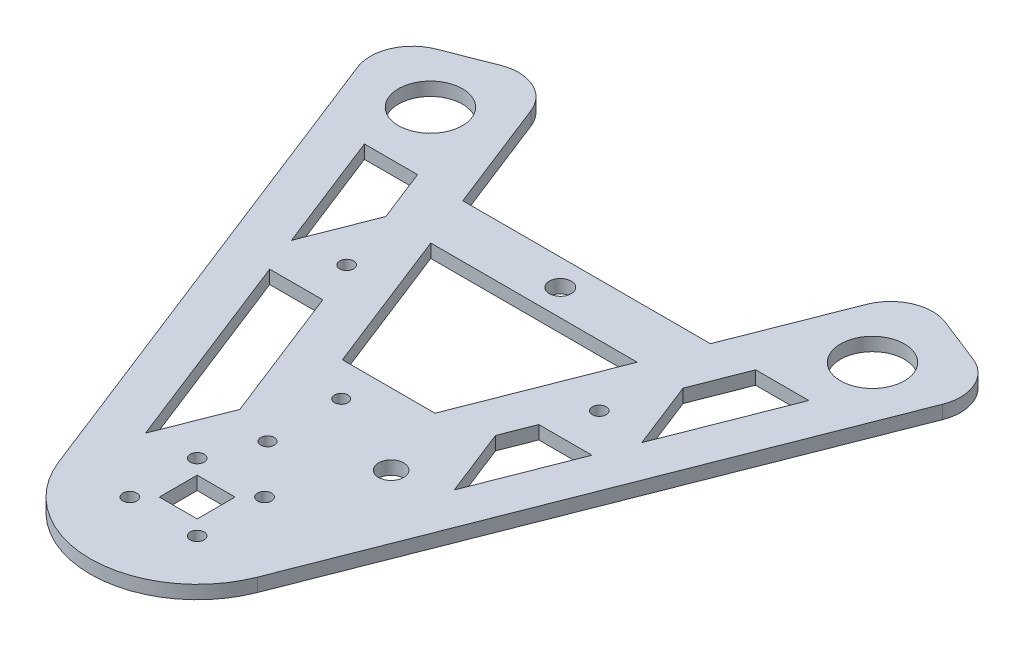
from build123d import *

# Parameters (mm, degrees)
SKETCH1_R               = 1.65
SKETCH1_R_2             = 1.6
SKETCH1_W               = 9
SKETCH1_H               = 9
SKETCH1_R_3             = 3
SKETCH1_R_4             = 7.6
SKETCH1_R_5             = 2.6
BOSS_EXTRUDE1_DEPTH     = 3.175
FILLET1_R               = 10
CUT_EXTRUDE1_DEPTH      = 144.809026836
CUT_EXTRUDE1_DEPTH_BACK = 144.809026836


with BuildPart() as part:
    # Sketch1 → Boss-Extrude1 (new body)
    with BuildSketch(Plane(origin=(0, 0, 0), x_dir=(1, 0, 0), z_dir=(0, 1, 0))):
        with BuildLine():
            Line((-43.508977325, 128.477858729), (-73.071649454, 116.897231949))
            Line((-73.071649454, 116.897231949), (-23.650137703, -9.264501423))
            ThreePointArc((-23.650137703, -9.264501423), (0, -25.4), (23.650137703, -9.264501423))
            Line((23.650137703, -9.264501423), (73.071649454, 116.897231949))
            Line((73.071649454, 116.897231949), (43.508977325, 128.477858729))
            Line((43.508977325, 128.477858729), (29.415320553, 92.5))
            Line((29.415320553, 92.5), (-29.415320553, 92.5))
            Line((-29.415320553, 92.5), (-43.508977325, 128.477858729))
        make_face()
        Polygon((-11, 45.489929298), (-24.518678121, 80), (24.518678121, 80), (11, 45.489929298), align=None, mode=Mode.SUBTRACT)
        with Locations((-8, -8)):
            Circle(SKETCH1_R, mode=Mode.SUBTRACT)
        with Locations((-8, 8)):
            Circle(SKETCH1_R, mode=Mode.SUBTRACT)
        with Locations((-3.1, 19.813804275)):
            Circle(SKETCH1_R_2, mode=Mode.SUBTRACT)
        with Locations((8, -8)):
            Circle(SKETCH1_R, mode=Mode.SUBTRACT)
        Rectangle(SKETCH1_W, SKETCH1_H, mode=Mode.SUBTRACT)
        with Locations((8, 8)):
            Circle(SKETCH1_R, mode=Mode.SUBTRACT)
        with Locations((17.5, 28.563804275)):
            Circle(SKETCH1_R_3, mode=Mode.SUBTRACT)
        with Locations((-30, 65.506327199)):
            Circle(SKETCH1_R, mode=Mode.SUBTRACT)
        with Locations((-52.5, 107.906209275)):
            Circle(SKETCH1_R_4, mode=Mode.SUBTRACT)
        with Locations((30, 65.506327199)):
            Circle(SKETCH1_R, mode=Mode.SUBTRACT)
        with Locations((52.5, 107.906209275)):
            Circle(SKETCH1_R_4, mode=Mode.SUBTRACT)
        with Locations((0, 86.25)):
            Circle(SKETCH1_R_5, mode=Mode.SUBTRACT)
        with Locations((-3.1, 37.313804275)):
            Circle(SKETCH1_R_2, mode=Mode.SUBTRACT)
    extrude(amount=BOSS_EXTRUDE1_DEPTH)

    # Fillet1
    fillet1_edges = [part.edges().sort_by_distance(p)[0] for p in [
        (73.071649454, 1.5875, -116.897231949),
        (43.508977325, 1.5875, -128.477858729),
        (-43.508977325, 1.5875, -128.477858729),
        (-73.071649454, 1.5875, -116.897231949),
    ]]
    fillet(fillet1_edges, radius=FILLET1_R)

    # Sketch2 → Cut-Extrude1 (cut, two sides: drawn at the far end of the back side and taken through both)
    with BuildSketch(Plane(origin=(0, 3.175, 0), x_dir=(1, 0, 0), z_dir=(0, 1, 0)).offset(-CUT_EXTRUDE1_DEPTH_BACK)):
        Polygon((-38.276585969, 55.489929298), (-25.657209129, 55.489929298), (-12.971869924, 23.10718086), (-19.281558344, 7), align=None)
        Polygon((-52.774592577, 92.5), (-41.610247832, 64), (-35.300559412, 80.10718086), (-40.155215736, 92.5), align=None)
        Polygon((25.657209129, 55.489929298), (38.276585969, 55.489929298), (29.070898197, 31.989929298), (22.761209777, 48.097110158), align=None)
        Polygon((40.155215736, 92.5), (52.774592577, 92.5), (41.610247832, 64), (35.300559412, 80.10718086), align=None)
    extrude(amount=CUT_EXTRUDE1_DEPTH + CUT_EXTRUDE1_DEPTH_BACK, mode=Mode.SUBTRACT)


solid = part.part
